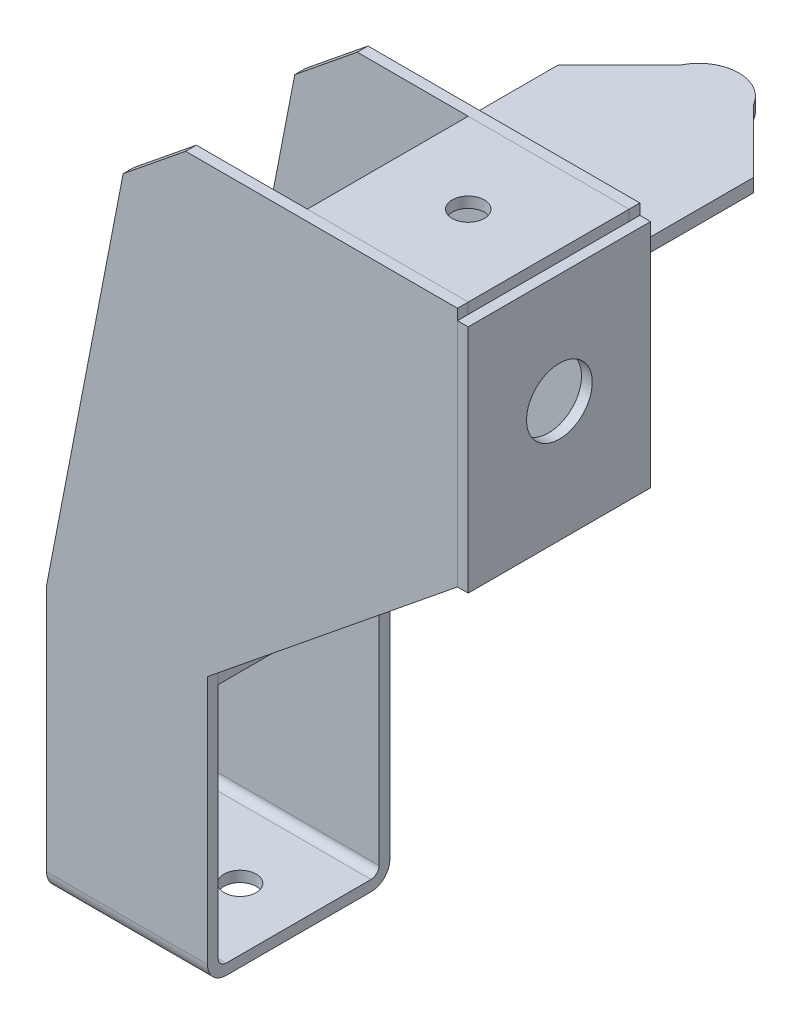
from build123d import *

# Parameters (mm, degrees)
BOSS_EXTRUDE2_DEPTH = 107
CUT_EXTRUDE1_DEPTH  = 214
SKETCH5_W           = 60
SKETCH5_H           = 4
BOSS_EXTRUDE3_DEPTH = 60
SKETCH6_W           = 60
SKETCH6_H           = 4
BOSS_EXTRUDE4_DEPTH = 60
SKETCH7_W           = 68
SKETCH7_H           = 86
BOSS_EXTRUDE5_DEPTH = 4
BOSS_EXTRUDE6_DEPTH = 100
CHAMFER1_SIZE       = 25
CHAMFER2_SIZE       = 25
SKETCH9_R           = 15
BOSS_EXTRUDE7_DEPTH = 5
SKETCH10_R          = 12.25
CUT_EXTRUDE2_DEPTH  = 4
SKETCH12_R          = 6
CUT_EXTRUDE5_DEPTH  = 8
SKETCH13_R          = 6
CUT_EXTRUDE6_DEPTH  = 10


with BuildPart() as part:
    # Sketch3 → Boss-Extrude2 (new, symmetric)
    with BuildSketch(Plane(origin=(0, 0, 0), x_dir=(0, 0, -1), z_dir=(1, 0, 0))):
        with BuildLine():
            Line((93.112387021, -93), (93.112387021, 165.555555556))
            Line((93.112387021, 165.555555556), (89.112387021, 165.555555556))
            Line((89.112387021, 165.555555556), (89.112387021, -93))
            ThreePointArc((89.112387021, -93), (88.233707365, -95.121320344), (86.112387021, -96))
            Line((86.112387021, -96), (32.112387021, -96))
            ThreePointArc((32.112387021, -96), (29.991066678, -95.121320344), (29.112387021, -93))
            Line((29.112387021, -93), (29.112387021, 165.555555556))
            Line((29.112387021, 165.555555556), (25.112387021, 165.555555556))
            Line((25.112387021, 165.555555556), (25.112387021, -93))
            ThreePointArc((25.112387021, -93), (27.162639553, -97.949747468), (32.112387021, -100))
            Line((32.112387021, -100), (86.112387021, -100))
            ThreePointArc((86.112387021, -100), (91.06213449, -97.949747468), (93.112387021, -93))
        make_face()
    extrude(amount=BOSS_EXTRUDE2_DEPTH, both=True)

    # Sketch4 → Cut-Extrude1 (cut)
    with BuildSketch(Plane.XY):
        Polygon((-190, 11.896699378), (-190, -230), (130, -230), (130, -61.975068301), (223.227453171, 13.580487255), (223.227453171, 295.555555556), (-54.204269584, 295.555555556), (-150.061773181, 217.868493514), align=None)
        Polygon((-60, -0.59060332), (-60, -100), (0, -100), (0, 0), (93.227453171, 75.555555556), (93.227453171, 165.555555556), (-8.139740481, 165.555555556), (-31.446603774, 146.666666667), align=None, mode=Mode.SUBTRACT)
    extrude(amount=-CUT_EXTRUDE1_DEPTH, mode=Mode.SUBTRACT)

    # Sketch13 → Cut-Extrude6 (cut)
    with BuildSketch(Plane.XZ.offset(100)):
        with Locations((-23.160596036, -60.439663785)):
            Circle(SKETCH13_R)
    extrude(amount=-CUT_EXTRUDE6_DEPTH, mode=Mode.SUBTRACT)


with BuildPart() as body_2:
    # Sketch5 → Boss-Extrude3 (new body)
    with BuildSketch(Plane(origin=(0, 0, 0), x_dir=(0, 0, -1), z_dir=(1, 0, 0))):
        with Locations((59.112387021, -2.59060332)):
            Rectangle(SKETCH5_W, SKETCH5_H)
    extrude(amount=-BOSS_EXTRUDE3_DEPTH)


with BuildPart() as body_3:
    # Sketch6 → Boss-Extrude4 (new body)
    with BuildSketch(Plane(origin=(93.227453171, 0, 0), x_dir=(0, 0, -1), z_dir=(1, 0, 0))):
        with Locations((59.112387021, 163.555555556)):
            Rectangle(SKETCH6_W, SKETCH6_H)
    extrude(amount=-BOSS_EXTRUDE4_DEPTH)

    # Sketch12 → Cut-Extrude5 (cut)
    with BuildSketch(Plane(origin=(0, 165.555555556, 0), x_dir=(1, 0, 0), z_dir=(0, 1, 0))):
        with Locations((63.227453171, 59.112387021)):
            Circle(SKETCH12_R)
    extrude(amount=-CUT_EXTRUDE5_DEPTH, mode=Mode.SUBTRACT)


with BuildPart() as body_4:
    # Sketch7 → Boss-Extrude5 (new body)
    with BuildSketch(Plane(origin=(93.227453171, 0, 0), x_dir=(0, 0, -1), z_dir=(1, 0, 0))):
        with Locations((59.112387021, 118.555555556)):
            Rectangle(SKETCH7_W, SKETCH7_H)
    extrude(amount=BOSS_EXTRUDE5_DEPTH)

    # Sketch10 → Cut-Extrude2 (cut)
    with BuildSketch(Plane(origin=(97.227453171, 0, 0), x_dir=(0, 0, -1), z_dir=(1, 0, 0))):
        with Locations((59.112387021, 120.555555556)):
            Circle(SKETCH10_R)
    extrude(amount=-CUT_EXTRUDE2_DEPTH, mode=Mode.SUBTRACT)


with BuildPart() as body_5:
    # Sketch8 → Boss-Extrude6 (new body)
    with BuildSketch(Plane(origin=(0, 0, -93.112387021), x_dir=(-1, 0, 0), z_dir=(0, 0, -1))):
        Polygon((-60.621778265, 115), (12.102062346, 115), (12.102062346, 117.5), (12.102062346, 120), (-60.621778265, 120), align=None)
    extrude(amount=BOSS_EXTRUDE6_DEPTH)

    # Chamfer1
    chamfer1_edges = [body_5.edges().sort_by_distance(p)[0] for p in [
        (-12.102062346, 117.5, -193.112387021),
    ]]
    chamfer(chamfer1_edges, length=CHAMFER1_SIZE)

    # Chamfer2
    chamfer2_edges = [body_5.edges().sort_by_distance(p)[0] for p in [
        (60.621778265, 117.5, -193.112387021),
    ]]
    chamfer(chamfer2_edges, length=CHAMFER2_SIZE)

    # Sketch9 → Boss-Extrude7 (add)
    with BuildSketch(Plane.XZ.offset(-115)):
        with Locations((24.121778265, -184.112387021)):
            Circle(SKETCH9_R)
    extrude(amount=-BOSS_EXTRUDE7_DEPTH)


solid = Compound([part.part, body_2.part, body_3.part, body_4.part, body_5.part])
